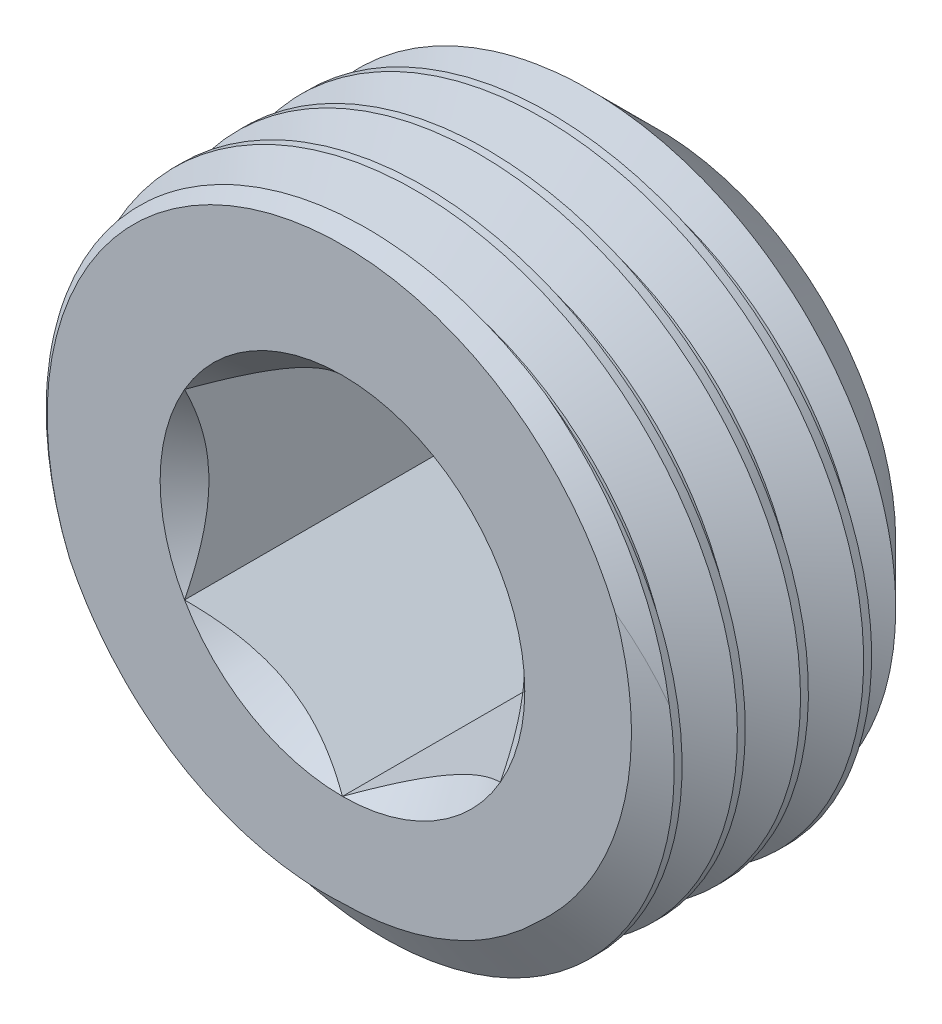
from build123d import *

# Parameters (mm, degrees)
CUT_EXTRUDE1_DEPTH = 12.993776721
SKETCH4_R          = 3.666174209
CUT_EXTRUDE2_DEPTH = 2.54
CUT_EXTRUDE2_DRAFT = -45
CUT_SWEEP1_PITCH   = 1.27
SKETCH8_W          = 4.438611414
SKETCH8_H          = 6.843853498


with BuildPart() as part:
    # Sketch2 → Revolve1 (revolve)
    with BuildSketch(Plane(origin=(0, 0, 0), x_dir=(0, 0, -1), z_dir=(1, 0, 0))):
        Polygon((-3.9751, 5.937555401), (-3.686303183, 6.35), (0.8001, 6.35), (3.9751, 3.175), (0.8001, 0), (-3.9751, 0), align=None)
    revolve(axis=Axis((0, 0, -0.8001), (0, 0, 1)))

    # Sketch3 → Cut-Extrude1 (cut, through all)
    with BuildSketch(Plane.XY.offset(3.9751)):
        Polygon((0, 3.666174209), (-3.175, 1.833087105), (-3.175, -1.833087105), (0, -3.666174209), (3.175, -1.833087105), (3.175, 1.833087105), align=None)
    extrude(amount=-CUT_EXTRUDE1_DEPTH, mode=Mode.SUBTRACT)


with BuildPart() as cut_extrude2_tool:
    # Sketch4 → Cut-Extrude2 (with draft: the straight prism first)
    with BuildSketch(Plane.XY.offset(3.9751)):
        Circle(SKETCH4_R)
    extrude(amount=-CUT_EXTRUDE2_DEPTH)
    # Cut-Extrude2: the draft: its side faces are tilted about the plane it starts from
    cut_extrude2_sides = [cut_extrude2_tool.faces().sort_by_distance(p)[0] for p in [
        (-3.666174209, 0, 2.7051),
    ]]
    draft(cut_extrude2_sides, Plane.XY.offset(3.9751), CUT_EXTRUDE2_DRAFT)


with BuildPart() as part_1:
    add(part.part)

    # Cut-Extrude2: cut by cut_extrude2_tool
    add(cut_extrude2_tool.part, mode=Mode.SUBTRACT)

    # Cut-Sweep1: the profile of Sketch7 screwed along a right-hand helix of 7.26 turns, 8 arcs to a turn; built about Z, then put on its axis
    cut_sweep1_z = Axis((0, 0, 0), (0, 0, 1))
    cut_sweep1_corners = [(6.418740766, 0, -1.1509375), (6.418740766, 0, 0.0396875), (5.525110803, 0, -0.47625), (5.525110803, 0, -0.635)]
    with BuildLine(mode=Mode.PRIVATE) as cut_sweep1_profile:
        Line(cut_sweep1_corners[0], cut_sweep1_corners[1])
        Line(cut_sweep1_corners[1], cut_sweep1_corners[2])
        Line(cut_sweep1_corners[2], cut_sweep1_corners[3])
        Line(cut_sweep1_corners[3], cut_sweep1_corners[0])
    cut_sweep1_cap = Face(cut_sweep1_profile.wire())
    cut_sweep1_turn_angles = [0, 22.5, 45, 67.5, 90, 112.5, 135, 157.5, 180, 202.5, 225, 247.5, 270, 292.5, 315, 337.5, 360]
    cut_sweep1_turn_weights = [1, 0.9238795325112867, 1, 0.9238795325112867, 1, 0.9238795325112867, 1, 0.9238795325112867, 1, 0.9238795325112867, 1, 0.9238795325112867, 1, 0.9238795325112867, 1, 0.9238795325112867, 1]
    cut_sweep1_turn_rails = [Edge.make_bspline([Vector(p[0], p[1], 0).rotate(cut_sweep1_z, cut_sweep1_turn_angles[k]) / cut_sweep1_turn_weights[k] + Vector(0, 0, p[2] + CUT_SWEEP1_PITCH * cut_sweep1_turn_angles[k] / 360) for k in range(17)], [0, 0, 0, 1, 1, 2, 2, 3, 3, 4, 4, 5, 5, 6, 6, 7, 7, 8, 8, 8], 2, cut_sweep1_turn_weights) for p in cut_sweep1_corners]
    cut_sweep1_turn_sides = [Face.make_surface_from_curves(cut_sweep1_turn_rails[p[0]], cut_sweep1_turn_rails[p[1]]) for p in [(0, 1), (1, 2), (2, 3), (3, 0)]]
    cut_sweep1_last_angles = [2520, 2542.5, 2565, 2587.5, 2610, 2611.8, 2613.6]
    cut_sweep1_last_weights = [1, 0.9238795325112867, 1, 0.9238795325112867, 1, 0.9995065603657309, 1]
    cut_sweep1_last_rails = [Edge.make_bspline([Vector(p[0], p[1], 0).rotate(cut_sweep1_z, cut_sweep1_last_angles[k]) / cut_sweep1_last_weights[k] + Vector(0, 0, p[2] + CUT_SWEEP1_PITCH * cut_sweep1_last_angles[k] / 360) for k in range(7)], [0, 0, 0, 1, 1, 2, 2, 3, 3, 3], 2, cut_sweep1_last_weights) for p in cut_sweep1_corners]
    cut_sweep1_last_sides = [Face.make_surface_from_curves(cut_sweep1_last_rails[p[0]], cut_sweep1_last_rails[p[1]]) for p in [(0, 1), (1, 2), (2, 3), (3, 0)]]
    cut_sweep1 = Plane(origin=(0, 0, 3.9751), x_dir=(0, 1, 0), z_dir=(0, 0, -1)) * Solid(Shell([*[p.moved(Location((0, 0, CUT_SWEEP1_PITCH * i))) for i in range(7) for p in cut_sweep1_turn_sides], *cut_sweep1_last_sides, cut_sweep1_cap, cut_sweep1_cap.rotate(cut_sweep1_z, 2613.6).moved(Location((0, 0, CUT_SWEEP1_PITCH * 2613.6 / 360)))]))
    add(cut_sweep1, mode=Mode.SUBTRACT)

    # Sketch8 → Cut-Revolve1 (revolve, cut)
    with BuildSketch(Plane(origin=(0, 0, 0), x_dir=(0, 0, -1), z_dir=(1, 0, 0)), mode=Mode.PRIVATE) as cut_revolve1_sk:
        with Locations((4.594205707, -3.421926749)):
            Rectangle(SKETCH8_W, SKETCH8_H)
    revolve(cut_revolve1_sk.sketch.rotate(Axis((0, 0, -5.684354634), (0, 0, 1)), 311.250884485), axis=Axis((0, 0, -5.684354634), (0, 0, 1)), mode=Mode.SUBTRACT)


solid = part_1.part
